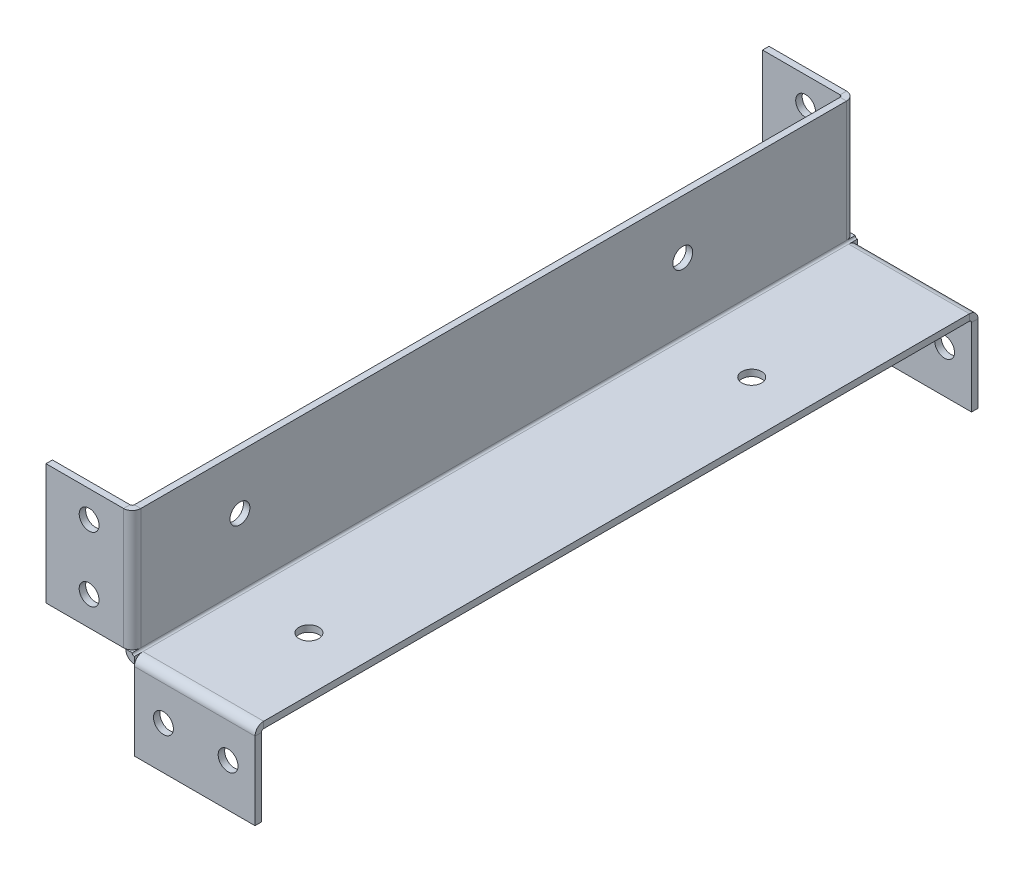
from build123d import *

# Parameters (mm, degrees)
SKETCH1_W                      = 60
SKETCH1_H                      = 335.5
BASE_FLANGE1_DEPTH             = 3
EDGE_FLANGE1_STRIP_W           = 14
EDGE_FLANGE1_STRIP_H           = 3
EDGE_FLANGE1_STRIP_CUT_DEPTH   = 335.5
EDGE_FLANGE1_DEPTH             = 335.5
EDGE_FLANGE2_STRIP_W           = 14
EDGE_FLANGE2_STRIP_H           = 3
EDGE_FLANGE2_STRIP_CUT_DEPTH   = 56
EDGE_FLANGE2_STRIP_2_W         = 14
EDGE_FLANGE2_STRIP_2_H         = 3
EDGE_FLANGE2_STRIP_CUT_2_DEPTH = 56
EDGE_FLANGE2_STRIP_3_W         = 14
EDGE_FLANGE2_STRIP_3_H         = 3
EDGE_FLANGE2_STRIP_CUT_3_DEPTH = 56
EDGE_FLANGE2_STRIP_4_W         = 14
EDGE_FLANGE2_STRIP_4_H         = 3
EDGE_FLANGE2_STRIP_CUT_4_DEPTH = 56
EDGE_FLANGE2_DEPTH             = 56
EDGE_FLANGE2_BEND_DEPTH        = 56
EDGE_FLANGE2_BEND_2_DEPTH      = 56
EDGE_FLANGE2_BEND_3_DEPTH      = 56
SKETCH18_R                     = 4.6
EXTRUDE1_DEPTH                 = 348.346009046
SKETCH21_R                     = 4.6
CUT_EXTRUDE1_DEPTH             = 10
SKETCH22_R                     = 4.6
CUT_EXTRUDE2_DEPTH             = 10


# Sheet-metal steps are written as plain solids
with BuildPart() as part:
    # Sketch1 → Base-Flange1 (new body)
    with BuildSketch(Plane(origin=(0, 0, 0), x_dir=(1, 0, 0), z_dir=(0, 1, 0))):
        Rectangle(SKETCH1_W, SKETCH1_H)
    extrude(amount=BASE_FLANGE1_DEPTH)

    # Edge-Flange1 strip (across the edge) → Edge-Flange1 strip cut (cut)
    with BuildSketch(Plane(origin=(-30, 3, -167.75), x_dir=(1, 0, 0), z_dir=(0, 0, 1))):
        with Locations((-3, -1.5)):
            Rectangle(EDGE_FLANGE1_STRIP_W, EDGE_FLANGE1_STRIP_H)
    extrude(amount=EDGE_FLANGE1_STRIP_CUT_DEPTH, mode=Mode.SUBTRACT)

    # Edge-Flange1 section (across the edge) → Edge-Flange1 (add)
    with BuildSketch(Plane(origin=(-30, 3, -167.75), x_dir=(1, 0, 0), z_dir=(0, 0, 1))):
        with BuildLine():
            Line((0, 1), (0, 57))
            Line((0, 57), (3, 57))
            Line((3, 57), (3, 1))
            ThreePointArc((3, 1), (3.292893219, 0.292893219), (4, 0))
            Line((4, 0), (4, -3))
            ThreePointArc((4, -3), (1.171572875, -1.828427125), (0, 1))
        make_face()
    extrude(amount=EDGE_FLANGE1_DEPTH)

    # Edge-Flange2 strip (across the edge) → Edge-Flange2 strip cut (cut)
    with BuildSketch(Plane(origin=(-30, 4, 167.75), x_dir=(0, 0, -1), z_dir=(0, 1, 0))):
        with Locations((-3, -1.5)):
            Rectangle(EDGE_FLANGE2_STRIP_W, EDGE_FLANGE2_STRIP_H)
    extrude(amount=EDGE_FLANGE2_STRIP_CUT_DEPTH, mode=Mode.SUBTRACT)

    # Edge-Flange2 strip 2 (across the edge) → Edge-Flange2 strip cut 2 (cut)
    with BuildSketch(Plane(origin=(30, 0, 167.75), x_dir=(0, 0, -1), z_dir=(-1, 0, 0))):
        with Locations((-3, -1.5)):
            Rectangle(EDGE_FLANGE2_STRIP_2_W, EDGE_FLANGE2_STRIP_2_H)
    extrude(amount=EDGE_FLANGE2_STRIP_CUT_2_DEPTH, mode=Mode.SUBTRACT)

    # Edge-Flange2 strip 3 (across the edge) → Edge-Flange2 strip cut 3 (cut)
    with BuildSketch(Plane(origin=(-30, 60, -167.75), x_dir=(0, 0, 1), z_dir=(0, -1, 0))):
        with Locations((-3, -1.5)):
            Rectangle(EDGE_FLANGE2_STRIP_3_W, EDGE_FLANGE2_STRIP_3_H)
    extrude(amount=EDGE_FLANGE2_STRIP_CUT_3_DEPTH, mode=Mode.SUBTRACT)

    # Edge-Flange2 strip 4 (across the edge) → Edge-Flange2 strip cut 4 (cut)
    with BuildSketch(Plane(origin=(-26, 0, -167.75), x_dir=(0, 0, 1), z_dir=(1, 0, 0))):
        with Locations((-3, -1.5)):
            Rectangle(EDGE_FLANGE2_STRIP_4_W, EDGE_FLANGE2_STRIP_4_H)
    extrude(amount=EDGE_FLANGE2_STRIP_CUT_4_DEPTH, mode=Mode.SUBTRACT)

    # Edge-Flange2 section (across the edge) → Edge-Flange2 (add)
    with BuildSketch(Plane(origin=(-30, 4, 167.75), x_dir=(0, 0, -1), z_dir=(0, 1, 0))):
        with BuildLine():
            Line((0, 1), (0, 37))
            Line((0, 37), (3, 37))
            Line((3, 37), (3, 1))
            ThreePointArc((3, 1), (3.292893219, 0.292893219), (4, 0))
            Line((4, 0), (4, -3))
            ThreePointArc((4, -3), (1.171572875, -1.828427125), (0, 1))
        make_face()
    extrude(amount=EDGE_FLANGE2_DEPTH)

    # Edge-Flange2 section 2 (across the edge) → Edge-Flange2 bend (add)
    with BuildSketch(Plane(origin=(30, 0, 167.75), x_dir=(0, 0, -1), z_dir=(-1, 0, 0))):
        with BuildLine():
            Line((0, 1), (0, 37))
            Line((0, 37), (3, 37))
            Line((3, 37), (3, 1))
            ThreePointArc((3, 1), (3.292893219, 0.292893219), (4, 0))
            Line((4, 0), (4, -3))
            ThreePointArc((4, -3), (1.171572875, -1.828427125), (0, 1))
        make_face()
    extrude(amount=EDGE_FLANGE2_BEND_DEPTH)

    # Edge-Flange2 section 3 (across the edge) → Edge-Flange2 bend 2 (add)
    with BuildSketch(Plane(origin=(-30, 60, -167.75), x_dir=(0, 0, 1), z_dir=(0, -1, 0))):
        with BuildLine():
            Line((0, 1), (0, 37))
            Line((0, 37), (3, 37))
            Line((3, 37), (3, 1))
            ThreePointArc((3, 1), (3.292893219, 0.292893219), (4, 0))
            Line((4, 0), (4, -3))
            ThreePointArc((4, -3), (1.171572875, -1.828427125), (0, 1))
        make_face()
    extrude(amount=EDGE_FLANGE2_BEND_2_DEPTH)

    # Edge-Flange2 section 4 (across the edge) → Edge-Flange2 bend 3 (add)
    with BuildSketch(Plane(origin=(-26, 0, -167.75), x_dir=(0, 0, 1), z_dir=(1, 0, 0))):
        with BuildLine():
            Line((0, 1), (0, 37))
            Line((0, 37), (3, 37))
            Line((3, 37), (3, 1))
            ThreePointArc((3, 1), (3.292893219, 0.292893219), (4, 0))
            Line((4, 0), (4, -3))
            ThreePointArc((4, -3), (1.171572875, -1.828427125), (0, 1))
        make_face()
    extrude(amount=EDGE_FLANGE2_BEND_3_DEPTH)

    # Sketch18 → Extrude1 (cut, through all)
    with BuildSketch(Plane.XY.offset(167.75)):
        with Locations((-47, 47.5)):
            Circle(SKETCH18_R)
        with Locations((-47, 17.5)):
            Circle(SKETCH18_R)
        with Locations((-12.5, -17)):
            Circle(SKETCH18_R)
        with Locations((17.5, -17)):
            Circle(SKETCH18_R)
    extrude(amount=-EXTRUDE1_DEPTH, mode=Mode.SUBTRACT)

    # Sketch21 → Cut-Extrude1 (cut)
    with BuildSketch(Plane.XZ):
        with Locations(Location((5, -87.75, 0), (0, 0, 270))):
            Circle(SKETCH21_R)
        with Locations(Location((5, 117.75, 0), (0, 0, 270))):
            Circle(SKETCH21_R)
    extrude(amount=-CUT_EXTRUDE1_DEPTH, mode=Mode.SUBTRACT)

    # Sketch22 → Cut-Extrude2 (cut)
    with BuildSketch(Plane.ZY.offset(30)):
        with Locations(Location((-87.75, 35, 0), (0, 0, 270))):
            Circle(SKETCH22_R)
        with Locations(Location((117.75, 35, 0), (0, 0, 270))):
            Circle(SKETCH22_R)
    extrude(amount=-CUT_EXTRUDE2_DEPTH, mode=Mode.SUBTRACT)


solid = part.part
